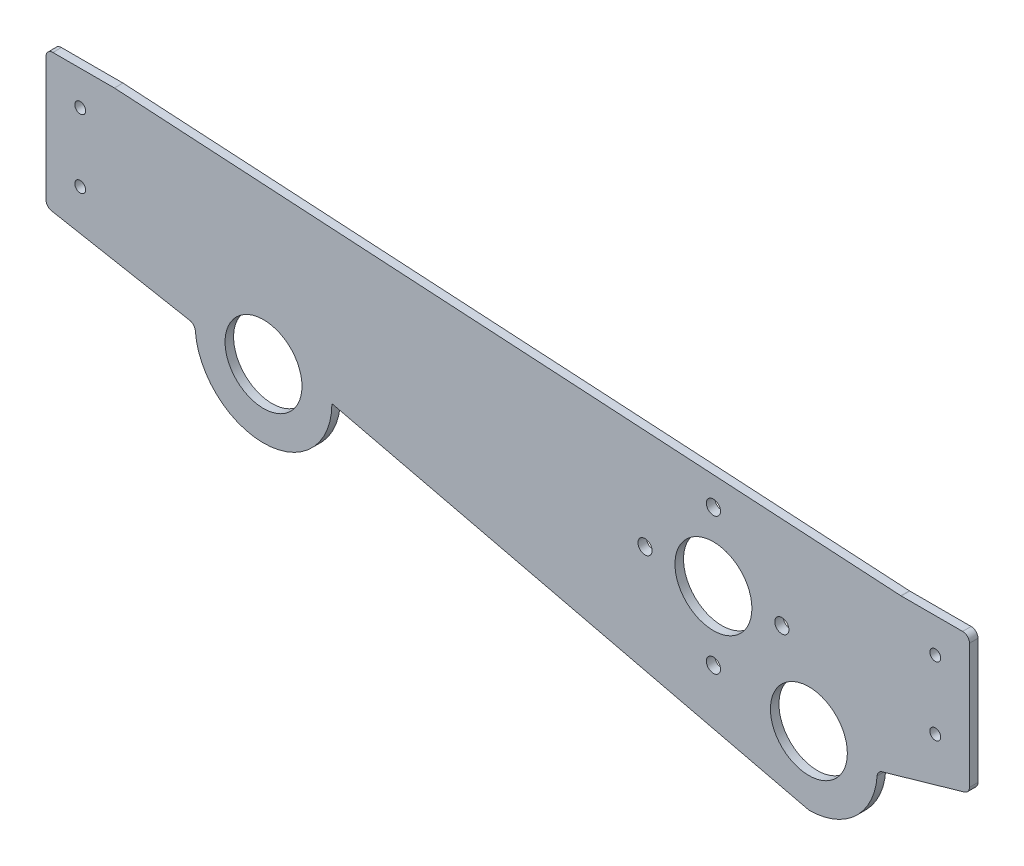
from build123d import *

# Parameters (mm, degrees)
SKETCH1_R           = 14.2875
SKETCH1_R_2         = 2.0193
BOSS_EXTRUDE1_DEPTH = 3.175
FILLET1_R           = 2.54
SKETCH2_R           = 14.2875
SKETCH2_R_2         = 2.6289
CUT_EXTRUDE1_DEPTH  = 238.443914509


with BuildPart() as part:
    # Sketch1 → Boss-Extrude1 (new body)
    with BuildSketch(Plane.XY):
        with BuildLine():
            Line((146.05, 146.96694), (-146.05, 164.23894))
            Line((-146.05, 164.23894), (-171.45, 164.23894))
            Line((-171.45, 164.23894), (-171.45, 113.43894))
            Line((-171.45, 113.43894), (-116.081416722, 103.131947821))
            ThreePointArc((-116.081416722, 103.131947821), (-90.681416722, 77.731947821), (-65.281416722, 103.131947821))
            Line((-65.281416722, 103.131947821), (100.376646224, 63.682232473))
            Line((100.376646224, 63.682232473), (111.82489431, 60.955953292))
            ThreePointArc((111.82489431, 60.955953292), (129.785406552, 68.395441049), (137.22489431, 86.355953292))
            Line((137.22489431, 86.355953292), (171.45, 96.16694))
            Line((171.45, 96.16694), (171.45, 146.96694))
            Line((171.45, 146.96694), (146.05, 146.96694))
        make_face()
        with Locations((-90.681416722, 103.131947821)):
            Circle(SKETCH1_R, mode=Mode.SUBTRACT)
        with Locations((111.82489431, 86.355953292)):
            Circle(SKETCH1_R, mode=Mode.SUBTRACT)
        with Locations((158.75, 108.86694)):
            Circle(SKETCH1_R_2, mode=Mode.SUBTRACT)
        with Locations((-158.75, 126.13894)):
            Circle(SKETCH1_R_2, mode=Mode.SUBTRACT)
        with Locations((-158.75, 151.53894)):
            Circle(SKETCH1_R_2, mode=Mode.SUBTRACT)
        with Locations((158.75, 134.26694)):
            Circle(SKETCH1_R_2, mode=Mode.SUBTRACT)
    extrude(amount=BOSS_EXTRUDE1_DEPTH)

    # Fillet1
    # the kernel refuses this fillet: 2.54 mm, written as the material it adds along each edge
    with BuildSketch(Plane(origin=(-116.081416722, 103.131947821, 0), x_dir=(0.03807134416902504, -0.9992750235811778, 0), z_dir=(0, 0, 1))) as fillet1_piece_1:
        with BuildLine():
            CenterArc((2.030725498, -2.53815856), FILLET1_R, 92.181854631, 75.091245619)
            Line((-0.446869803, -1.978585935), (0, 0))
            ThreePointArc((0, 0), (0.967012142, -0.018414401), (1.934024284, 0))
        make_face()
    extrude(amount=3.175)
    with BuildSketch(Plane(origin=(146.05, 146.96694, 0), x_dir=(-0.9982563668513765, 0.05902733299658733, 0), z_dir=(0, 0, 1))) as fillet1_piece_2:
        with BuildLine():
            CenterArc((FILLET1_R * 0.0295394194538, -FILLET1_R), FILLET1_R, 90, 3.383984094)
            Line((-FILLET1_R * 0.0294879135427, -FILLET1_R * 0.00174363314863), (0, 0))
            Line((0, 0), (FILLET1_R * 0.0295394194537, 0))
        make_face()
    extrude(amount=3.175)
    with BuildSketch(Plane(origin=(137.22489431, 86.355953292, 0), x_dir=(0.9612833075503745, 0.2755619760144931, 0), z_dir=(0, 0, 1))) as fillet1_piece_3:
        with BuildLine():
            CenterArc((1.844513026, -2.54), FILLET1_R, 90, 70.036589556)
            ThreePointArc((-0.542860523, -1.672793255), (-0.256948075, -0.841096436), (0, 0))
            Line((0, 0), (1.844513026, 0))
        make_face()
    extrude(amount=3.175)
    # the kernel refuses this fillet: 2.54 mm, written as the material it takes off along each edge
    with BuildSketch(Plane(origin=(-171.45, 113.43894, -5.277017888), x_dir=(0, 1, 0), z_dir=(0, 0, 1))) as fillet1_2_piece_1:
        with BuildLine():
            CenterArc((FILLET1_R * 0.831026439026, -FILLET1_R), FILLET1_R, 90, 79.454954882)
            Line((-FILLET1_R * 0.152084893732, -FILLET1_R * 0.816991510029), (0, 0))
            Line((0, 0), (FILLET1_R * 0.831026439026, 0))
        make_face()
    extrude(amount=13.729035776, mode=Mode.SUBTRACT)
    with BuildSketch(Plane(origin=(-171.45, 164.23894, -6.35), x_dir=(1, 0, 0), z_dir=(0, 0, 1)), Plane(origin=(171.45, 146.96694, -6.35), x_dir=(0, -1, 0), z_dir=(0, 0, 1))) as fillet1_2_piece_2:
        with BuildLine():
            CenterArc((FILLET1_R, -FILLET1_R), FILLET1_R, 90, 90)
            Line((0, -FILLET1_R), (0, 0))
            Line((0, 0), (FILLET1_R, 0))
        make_face()
    extrude(amount=15.875, mode=Mode.SUBTRACT)
    with BuildSketch(Plane(origin=(171.45, 96.16694, -4.78545858), x_dir=(-0.9612833075503753, -0.2755619760144905, 0), z_dir=(0, 0, 1))) as fillet1_2_piece_3:
        with BuildLine():
            CenterArc((FILLET1_R * 0.753615524472, -FILLET1_R), FILLET1_R, 90, 74.004492945)
            Line((-FILLET1_R * 0.207667783079, -FILLET1_R * 0.724438023986), (0, 0))
            Line((0, 0), (FILLET1_R * 0.753615524472, 0))
        make_face()
    extrude(amount=12.745917161, mode=Mode.SUBTRACT)

    # Sketch2 → Cut-Extrude1 (cut, through all)
    with BuildSketch(Plane.XY.offset(3.175)):
        with Locations((76.380709582, 115.23549915)):
            Circle(SKETCH2_R)
        with Locations((76.380709582, 140.63549915)):
            Circle(SKETCH2_R_2)
        with Locations((101.780709582, 115.23549915)):
            Circle(SKETCH2_R_2)
        with Locations((76.380709582, 89.83549915)):
            Circle(SKETCH2_R_2)
        with Locations((50.980709582, 115.23549915)):
            Circle(SKETCH2_R_2)
    extrude(amount=-CUT_EXTRUDE1_DEPTH, mode=Mode.SUBTRACT)


solid = part.part
